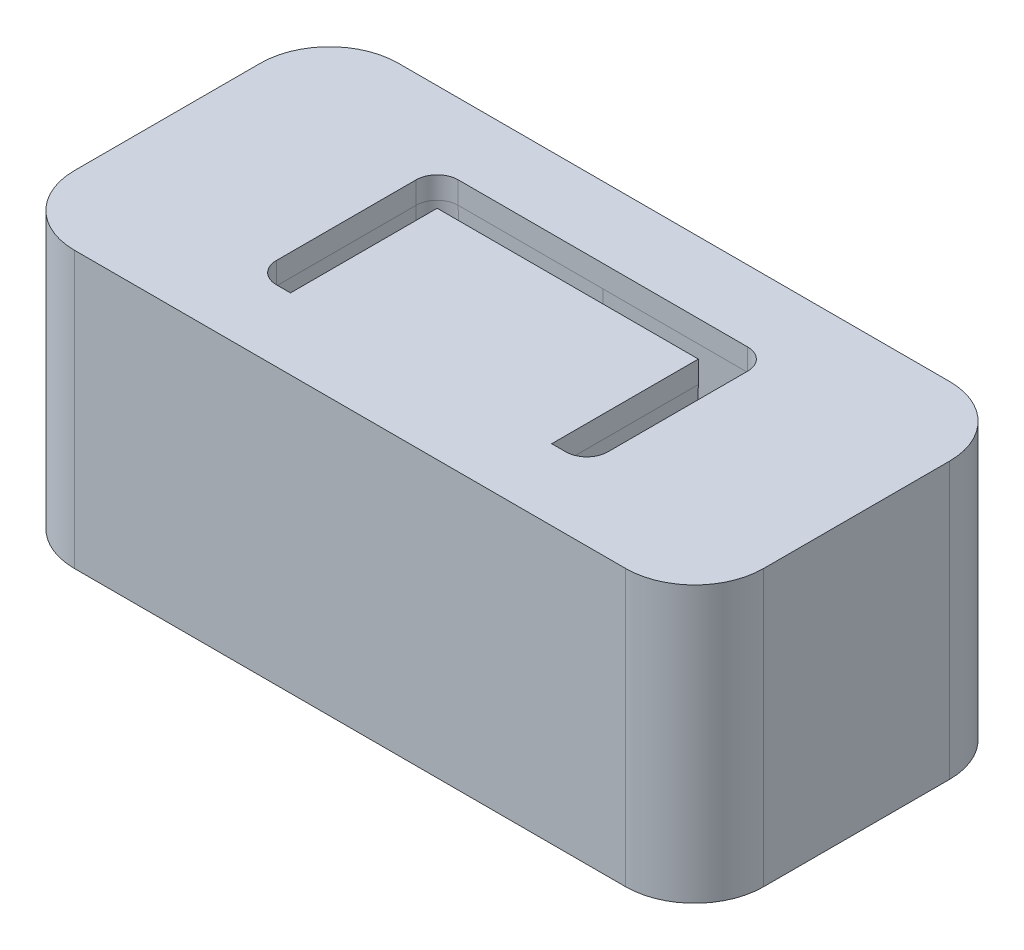
from build123d import *

# Parameters (mm, degrees)
SKETCH2_W                   = 100
SKETCH2_H                   = 47
BOSS_EXTRUDE1_DEPTH         = 40
FILLET1_R                   = 10
CUT_EXTRUDE1_REACH          = 70.207
M6_TAPPED_HOLE1_D           = 5
M6_TAPPED_HOLE1_DEPTH       = 17
M6_TAPPED_HOLE1_CSINK_D     = 6.05
M6_TAPPED_HOLE1_CSINK_ANGLE = 90
M6_TAPPED_HOLE1_TIP         = 1.502151548


with BuildPart() as part:
    # Sketch2 → Boss-Extrude1 (new body)
    with BuildSketch(Plane(origin=(0, 0, 0), x_dir=(1, 0, 0), z_dir=(0, 1, 0))):
        Rectangle(SKETCH2_W, SKETCH2_H)
    extrude(amount=-BOSS_EXTRUDE1_DEPTH)

    # Fillet1
    fillet1_edges = [part.edges().sort_by_distance(p)[0] for p in [
        (-50, -20, -23.5),
        (50, -20, -23.5),
        (50, -20, 23.5),
        (-50, -20, 23.5),
    ]]
    fillet(fillet1_edges, radius=FILLET1_R)

    # Sketch3 → Cut-Extrude1 (cut, up to next)
    with BuildSketch(Plane(origin=(0, 0, 0), x_dir=(1, 0, 0), z_dir=(0, 1, 0)), mode=Mode.PRIVATE) as cut_extrude1_sk1:
        with BuildLine():
            Line((24.05, -10.14), (24.05, 10.14))
            ThreePointArc((24.05, 10.14), (23.156675683, 12.296675683), (21, 13.19))
            Line((21, 13.19), (-21, 13.19))
            ThreePointArc((-21, 13.19), (-23.156675683, 12.296675683), (-24.05, 10.14))
            Line((-24.05, 10.14), (-24.05, -10.14))
            ThreePointArc((-24.05, -10.14), (-23.156675683, -12.296675683), (-21, -13.19))
            Line((-21, -13.19), (-18.95, -13.19))
            Line((-18.95, -13.19), (-18.95, 8.09))
            Line((-18.95, 8.09), (18.95, 8.09))
            Line((18.95, 8.09), (18.95, -13.19))
            Line((18.95, -13.19), (21, -13.19))
            ThreePointArc((21, -13.19), (23.156675683, -12.296675683), (24.05, -10.14))
        make_face()
    cut_extrude1_tool1 = extrude(cut_extrude1_sk1.sketch, amount=-CUT_EXTRUDE1_REACH, mode=Mode.PRIVATE) & part.part
    add(cut_extrude1_tool1.solids().sort_by_distance((23.50141, 0, 0))[0], mode=Mode.SUBTRACT)

    # M6 Tapped Hole1
    with Locations(Plane(origin=(0, -40, 0), x_dir=(-1, 0, 0), z_dir=(0, -1, 0))):
        with Locations((-43, 16.5), (43, 16.5), (43, -16.5), (-43, -16.5)):
            CounterSinkHole(M6_TAPPED_HOLE1_D / 2, M6_TAPPED_HOLE1_CSINK_D / 2, depth=M6_TAPPED_HOLE1_DEPTH, counter_sink_angle=M6_TAPPED_HOLE1_CSINK_ANGLE)
            with Locations((0, 0, -(M6_TAPPED_HOLE1_DEPTH + M6_TAPPED_HOLE1_TIP / 2))):  # 118° drill point
                Cone(0, M6_TAPPED_HOLE1_D / 2, M6_TAPPED_HOLE1_TIP, mode=Mode.SUBTRACT)

    # Cut-Sweep1: sweep along a path in Sketch8
    with BuildLine(Plane(origin=(0, 0, 0), x_dir=(1, 0, 0), z_dir=(0, 1, 0))) as cut_sweep1_path:
        Line((18.95, 8.09), (18.95, -13.19))
        Line((18.95, -13.19), (21, -13.19))
        ThreePointArc((21, -13.19), (23.156675683, -12.296675683), (24.05, -10.14))
        Line((24.05, -10.14), (24.05, 10.14))
        ThreePointArc((24.05, 10.14), (23.156675683, 12.296675683), (21, 13.19))
        Line((21, 13.19), (-21, 13.19))
        ThreePointArc((-21, 13.19), (-23.156675683, 12.296675683), (-24.05, 10.14))
        Line((-24.05, 10.14), (-24.05, -10.14))
        ThreePointArc((-24.05, -10.14), (-23.156675683, -12.296675683), (-21, -13.19))
        Line((-21, -13.19), (-18.95, -13.19))
        Line((-18.95, -13.19), (-18.95, 8.09))
        Line((-18.95, 8.09), (18.95, 8.09))
    # Sketch7 → Cut-Sweep1 (sweep, cut)
    with BuildSketch(Plane(origin=(0, 0, 0), x_dir=(0, 0, -1), z_dir=(1, 0, 0))):
        Polygon((13.19, -3.2), (13.832346389, -40), (13.19, -40), align=None)
    sweep(path=cut_sweep1_path.line, transition=Transition.RIGHT, mode=Mode.SUBTRACT)


solid = part.part
